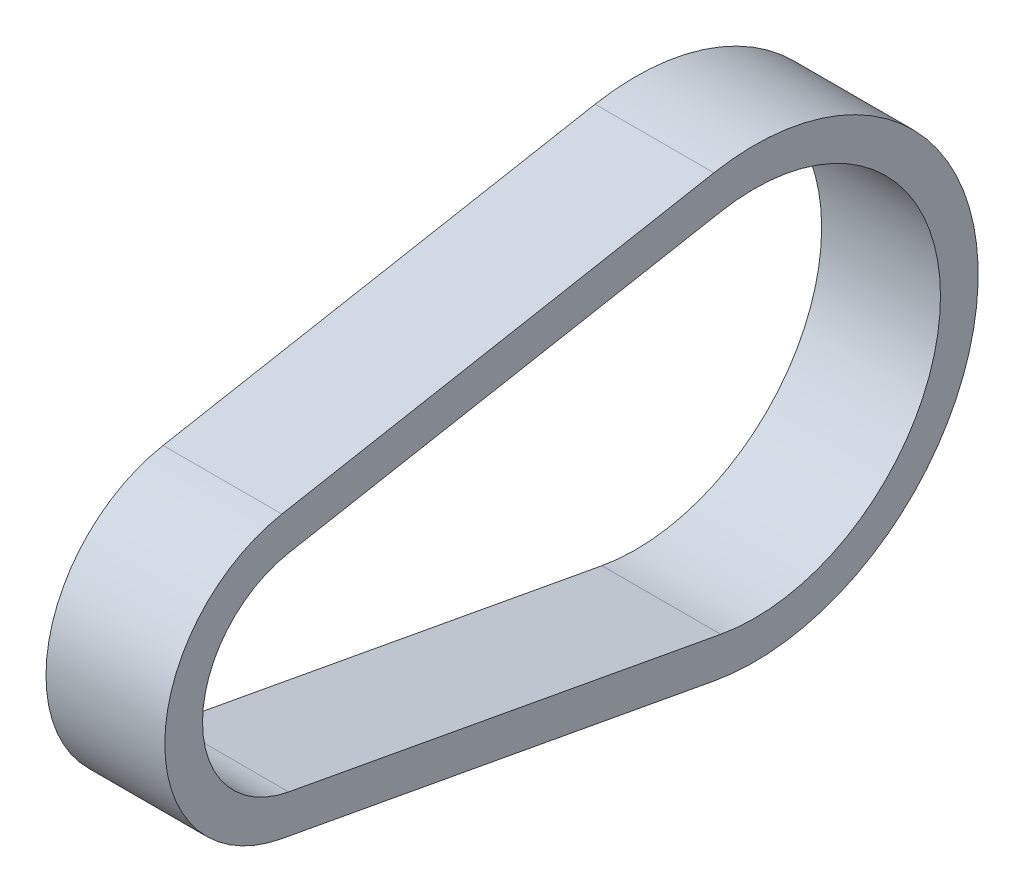
from build123d import *

# Parameters (mm, degrees)
BOSS_EXTRUDE1_DEPTH = 7.5


with BuildPart() as part:
    # Sketch1 → Boss-Extrude1 (new, symmetric)
    with BuildSketch(Plane(origin=(0, 0, 0), x_dir=(0, 0, -1), z_dir=(1, 0, 0))):
        with BuildLine():
            Line((-3.266661591, 17.748585942), (51.281145188, 27.788215344))
            ThreePointArc((51.281145188, 27.788215344), (84.65058, 0), (51.281145188, -27.788215344))
            Line((51.281145188, -27.788215344), (-3.266661591, -17.748585942))
            ThreePointArc((-3.266661591, -17.748585942), (-18.0467, 0), (-3.266661591, 17.748585942))
        make_face()
        with BuildLine():
            Line((-2.404593965, 13.064757843), (52.143212814, 23.104387245))
            ThreePointArc((52.143212814, 23.104387245), (79.88808, 0), (52.143212814, -23.104387245))
            Line((52.143212814, -23.104387245), (-2.404593965, -13.064757843))
            ThreePointArc((-2.404593965, -13.064757843), (-13.2842, 0), (-2.404593965, 13.064757843))
        make_face(mode=Mode.SUBTRACT)
    extrude(amount=BOSS_EXTRUDE1_DEPTH, both=True)


solid = part.part
